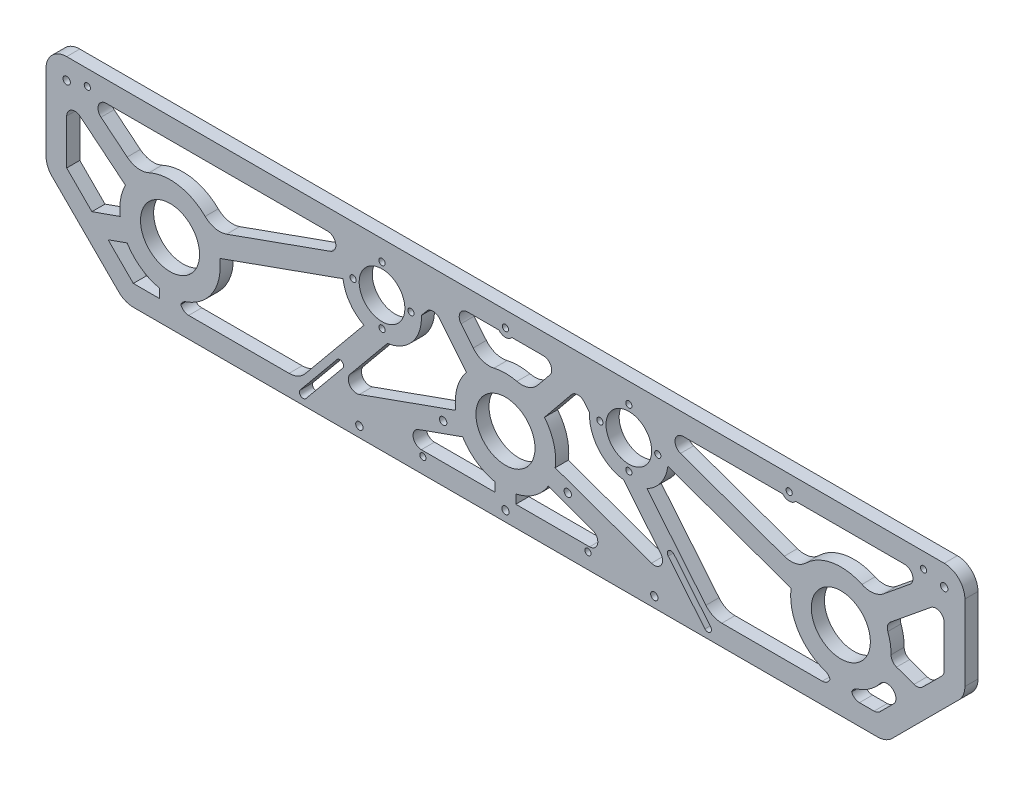
from build123d import *

# Parameters (mm, degrees)
SKETCH1_R           = 14.2875
BOSS_EXTRUDE1_DEPTH = 6.35
BOSS_EXTRUDE2_DEPTH = 6.35
FILLET1_R           = 10
FILLET2_R           = 4
FILLET3_R           = 4
SKETCH3_R           = 1.778
CUT_EXTRUDE1_DEPTH  = 10
CUT_EXTRUDE2_DEPTH  = 10
SKETCH6_R           = 19.05
SKETCH6_R_2         = 11.049
SKETCH6_R_3         = 1.5
BOSS_EXTRUDE3_DEPTH = 6.35
SKETCH6_5_R         = 11.049
SKETCH6_5_R_2       = 1.5
CUT_EXTRUDE4_DEPTH  = 10
SKETCH7_R           = 1.778
CUT_EXTRUDE5_DEPTH  = 10
SKETCH8_R           = 1.778
CUT_EXTRUDE6_DEPTH  = 10
SKETCH9_R           = 1.5
CUT_EXTRUDE7_DEPTH  = 10
SKETCH10_R          = 4
SKETCH10_R_2        = 1.5
BOSS_EXTRUDE4_DEPTH = 6.35
SKETCH10_4_R        = 1.5
CUT_EXTRUDE8_DEPTH  = 10


with BuildPart() as part:
    # Sketch1 → Boss-Extrude1 (new body)
    with BuildSketch(Plane.XY):
        with BuildLine():
            Line((2.928932188, 35.171067812), (35.171067812, 2.928932188))
            ThreePointArc((35.171067812, 2.928932188), (38.4153013, 0.761204675), (42.242135624, 0))
            Line((42.242135624, 0), (402.257864376, 0))
            ThreePointArc((402.257864376, 0), (406.0846987, 0.761204675), (409.328932188, 2.928932188))
            Line((409.328932188, 2.928932188), (441.571067812, 35.171067812))
            ThreePointArc((441.571067812, 35.171067812), (443.738795325, 38.4153013), (444.5, 42.242135624))
            Line((444.5, 42.242135624), (444.5, 78.9))
            ThreePointArc((444.5, 78.9), (441.571067812, 85.971067812), (434.5, 88.9))
            Line((434.5, 88.9), (10, 88.9))
            ThreePointArc((10, 88.9), (2.928932188, 85.971067812), (0, 78.9))
            Line((0, 78.9), (0, 42.242135624))
            ThreePointArc((0, 42.242135624), (0.761204675, 38.4153013), (2.928932188, 35.171067812))
        make_face()
        with Locations((60, 38.1)):
            Circle(SKETCH1_R, mode=Mode.SUBTRACT)
        with Locations((384.5, 38.1)):
            Circle(SKETCH1_R, mode=Mode.SUBTRACT)
        with Locations((222.25, 38.1)):
            Circle(SKETCH1_R, mode=Mode.SUBTRACT)
        with BuildLine():
            Line((42.242135624, 10), (55, 10))
            Line((55, 10), (55, 14.332739824))
            ThreePointArc((55, 14.332739824), (45.977844894, 18.269169901), (39.258984185, 25.463033624))
            Line((39.258984185, 25.463033624), (30.039080729, 22.203054895))
            Line((30.039080729, 22.203054895), (42.242135624, 10))
        make_face(mode=Mode.SUBTRACT)
        with BuildLine():
            Line((402.257864376, 10), (414.460919271, 22.203054895))
            Line((414.460919271, 22.203054895), (405.241015815, 25.463033624))
            ThreePointArc((405.241015815, 25.463033624), (398.522155106, 18.269169901), (389.5, 14.332739824))
            Line((389.5, 14.332739824), (389.5, 10))
            Line((389.5, 10), (402.257864376, 10))
        make_face(mode=Mode.SUBTRACT)
        with BuildLine():
            Line((434.5, 42.242135624), (434.5, 72.446597797))
            Line((434.5, 72.446597797), (406.075642814, 49.252322333))
            ThreePointArc((406.075642814, 49.252322333), (408.427959025, 42.263584169), (408.574576932, 34.891043503))
            Line((408.574576932, 34.891043503), (420.045712746, 30.835072751))
            Line((420.045712746, 30.835072751), (422.296945105, 30.039080729))
            Line((422.296945105, 30.039080729), (434.5, 42.242135624))
        make_face(mode=Mode.SUBTRACT)
        with BuildLine():
            Line((17.908581132, 78.9), (159.303289572, 78.9))
            Line((159.303289572, 78.9), (80.698128287, 50.807090212))
            ThreePointArc((80.698128287, 50.807090212), (64.123087075, 62.034970424), (44.746603764, 57.000173532))
            Line((44.746603764, 57.000173532), (17.908581132, 78.9))
        make_face(mode=Mode.SUBTRACT)
        with BuildLine():
            Line((10, 42.242135624), (10, 72.446597797))
            Line((10, 72.446597797), (38.424357186, 49.252322333))
            ThreePointArc((38.424357186, 49.252322333), (36.072040975, 42.263584169), (35.925423068, 34.891043503))
            Line((35.925423068, 34.891043503), (24.454287254, 30.835072751))
            Line((24.454287254, 30.835072751), (22.203054895, 30.039080729))
            Line((22.203054895, 30.039080729), (10, 42.242135624))
        make_face(mode=Mode.SUBTRACT)
        with BuildLine():
            Line((65, 14.332739824), (65, 10))
            Line((65, 10), (128.768147223, 10))
            Line((128.768147223, 10), (141.942274838, 14.708336864))
            Line((141.942274838, 14.708336864), (198.186421388, 34.809583517))
            ThreePointArc((198.186421388, 34.809583517), (198.85545044, 44.625159549), (203.363262878, 53.370030031))
            Line((203.363262878, 53.370030031), (185.140287975, 75.742288539))
            Line((185.140287975, 75.742288539), (184.022239752, 77.114910957))
            Line((184.022239752, 77.114910957), (175.842867511, 74.191663136))
            Line((175.842867511, 74.191663136), (84.063578612, 41.390416483))
            ThreePointArc((84.063578612, 41.390416483), (79.854530137, 24.1114229), (65, 14.332739824))
        make_face(mode=Mode.SUBTRACT)
        with BuildLine():
            Line((399.753396236, 57.000173532), (426.591418868, 78.9))
            Line((426.591418868, 78.9), (285.196710428, 78.9))
            Line((285.196710428, 78.9), (363.801871713, 50.807090212))
            ThreePointArc((363.801871713, 50.807090212), (380.376912925, 62.034970424), (399.753396236, 57.000173532))
        make_face(mode=Mode.SUBTRACT)
        with BuildLine():
            Line((158.481852777, 10), (201.551871713, 25.392909788))
            ThreePointArc((201.551871713, 25.392909788), (208.2614229, 18.245469863), (217.25, 14.332739824))
            Line((217.25, 14.332739824), (217.25, 10))
            Line((217.25, 10), (158.481852777, 10))
        make_face(mode=Mode.SUBTRACT)
        with BuildLine():
            Line((195.465766991, 78.9), (211.116677179, 59.685452953))
            ThreePointArc((211.116677179, 59.685452953), (222.25, 62.3875), (233.383322821, 59.685452953))
            Line((233.383322821, 59.685452953), (249.034233009, 78.9))
            Line((249.034233009, 78.9), (195.465766991, 78.9))
        make_face(mode=Mode.SUBTRACT)
        with BuildLine():
            Line((379.5, 14.332739824), (379.5, 10))
            Line((379.5, 10), (315.731852777, 10))
            Line((315.731852777, 10), (302.557725162, 14.708336864))
            Line((302.557725162, 14.708336864), (246.313578612, 34.809583517))
            ThreePointArc((246.313578612, 34.809583517), (245.64454956, 44.625159549), (241.136737122, 53.370030031))
            Line((241.136737122, 53.370030031), (259.359712025, 75.742288539))
            Line((259.359712025, 75.742288539), (260.477760248, 77.114910957))
            Line((260.477760248, 77.114910957), (268.657132489, 74.191663136))
            Line((268.657132489, 74.191663136), (360.436421388, 41.390416483))
            ThreePointArc((360.436421388, 41.390416483), (364.645469863, 24.1114229), (379.5, 14.332739824))
        make_face(mode=Mode.SUBTRACT)
        with BuildLine():
            Line((286.018147223, 10), (227.25, 10))
            Line((227.25, 10), (227.25, 14.332739824))
            ThreePointArc((227.25, 14.332739824), (236.2385771, 18.245469863), (242.948128287, 25.392909788))
            Line((242.948128287, 25.392909788), (286.018147223, 10))
        make_face(mode=Mode.SUBTRACT)
    extrude(amount=BOSS_EXTRUDE1_DEPTH)

    # Sketch2 → Boss-Extrude2 (add)
    with BuildSketch(Plane.XY.offset(6.35)):
        Polygon((184.022239752, 77.114910957), (174.845752388, 73.835301483), (124.908015982, 13.177953241), (122.291683488, 10), (128.768147223, 10), (137.944634587, 13.279609474), (187.243188129, 73.160568149), align=None)
        Polygon((269.654247612, 73.835301483), (319.591984018, 13.177953241), (322.208316512, 10), (315.731852777, 10), (306.555365413, 13.279609474), (257.256811871, 73.160568149), (260.477760248, 77.114910957), align=None)
    extrude(amount=-BOSS_EXTRUDE2_DEPTH)

    # Fillet1
    fillet1_edges = [part.edges().sort_by_distance(p)[0] for p in [
        (211.116677179, 59.685452953, 3.175),
        (233.383322821, 59.685452953, 3.175),
        (44.746603764, 57.000173532, 3.175),
        (80.698128287, 50.807090212, 3.175),
        (399.753396236, 57.000173532, 3.175),
        (363.801871713, 50.807090212, 3.175),
        (122.291683488, 10, 3.175),
        (322.208316512, 10, 3.175),
    ]]
    fillet(fillet1_edges, radius=FILLET1_R)

    # Fillet2
    fillet2_edges = [part.edges().sort_by_distance(p)[0] for p in [
        (249.034233009, 78.9, 3.175),
        (195.465766991, 78.9, 3.175),
        (286.018147223, 10, 3.175),
        (159.303289572, 78.9, 3.175),
        (17.908581132, 78.9, 3.175),
        (158.481852777, 10, 3.175),
        (10, 72.446597797, 3.175),
        (426.591418868, 78.9, 3.175),
        (285.196710428, 78.9, 3.175),
        (434.5, 72.446597797, 3.175),
        (174.845752388, 73.835301483, 3.175),
        (187.243188129, 73.160568149, 3.175),
        (137.944634587, 13.279609474, 3.175),
        (269.654247612, 73.835301483, 3.175),
        (306.555365413, 13.279609474, 3.175),
        (257.256811871, 73.160568149, 3.175),
    ]]
    fillet(fillet2_edges, radius=FILLET2_R)

    # Fillet3
    # the kernel refuses this fillet: 4 mm, written as the material it adds along each edge
    with BuildSketch(Plane(origin=(434.5, 42.242135624, 0), x_dir=(0, 1, 0), z_dir=(0, 0, 1)), Plane(origin=(402.257864376, 10, 0), x_dir=(0.7071067811865684, 0.7071067811865266, 0), z_dir=(0, 0, 1))) as fillet3_piece_1:
        with BuildLine():
            CenterArc((FILLET3_R * 0.414213562373, FILLET3_R), FILLET3_R, 225, 45)
            Line((-FILLET3_R * 0.292893218813, FILLET3_R * 0.292893218813), (0, 0))
            Line((0, 0), (FILLET3_R * 0.414213562373, 0))
        make_face()
    extrude(amount=6.35)
    with BuildSketch(Plane(origin=(422.296945105, 30.039080729, 0), x_dir=(-0.9428009879202438, 0.33335611165330736, 0), z_dir=(0, 0, 1))) as fillet3_piece_2:
        with BuildLine():
            CenterArc((FILLET3_R * 0.630618821441, -FILLET3_R), FILLET3_R, 90, 64.47260491)
            Line((-FILLET3_R * 0.271760517527, -FILLET3_R * 0.569057395232), (0, 0))
            Line((0, 0), (FILLET3_R * 0.630618821441, 0))
        make_face()
    extrude(amount=6.35)
    with BuildSketch(Plane(origin=(408.574576932, 34.891043503, 0), x_dir=(0.07422292500138471, 0.9972416745223992, 0), z_dir=(0, 0, 1)), Plane(origin=(389.5, 14.332739824, 0), x_dir=(0.9649431016089534, 0.262459159979783, 0), z_dir=(0, 0, 1)), Plane(origin=(65, 14.332739824, 0), x_dir=(0.9649431016089596, 0.2624591599797595, 0), z_dir=(0, 0, 1))) as fillet3_piece_3:
        with BuildLine():
            CenterArc((3.059187738, -3.993222777), FILLET3_R, 93.335760439, 71.44820939)
            Line((-0.800584668, -2.943386137), (0, 0))
            ThreePointArc((0, 0), (1.413219633, -0.04115045), (2.826439265, 0))
        make_face()
    extrude(amount=6.35)
    with BuildSketch(Plane(origin=(406.075642814, 49.252322333, 0), x_dir=(0.774785119901029, 0.632224657839243, 0), z_dir=(0, 0, 1))) as fillet3_piece_4:
        with BuildLine():
            CenterArc((3.050320928, -4), FILLET3_R, 90, 71.44820939)
            ThreePointArc((-0.741824875, -2.727353071), (-0.331204595, -1.374476848), (0, 0))
            Line((0, 0), (3.050320928, 0))
        make_face()
    extrude(amount=6.35)
    with BuildSketch(Plane(origin=(414.460919271, 22.203054895, 0), x_dir=(-0.9428009879202406, 0.33335611165331624, 0), z_dir=(0, 0, 1))) as fillet3_piece_5:
        with BuildLine():
            CenterArc((FILLET3_R * 1.58574398036, FILLET3_R), FILLET3_R, 154.47260491, 115.52739509)
            Line((FILLET3_R * 0.68336464139, FILLET3_R * 1.43094260477), (0, 0))
            Line((0, 0), (FILLET3_R * 1.58574398036, 0))
        make_face()
    extrude(amount=6.35)
    with BuildSketch(Plane(origin=(405.241015815, 25.463033624, 0), x_dir=(-0.5691164356367163, -0.82225694444508, 0), z_dir=(0, 0, 1)), Plane(origin=(379.5, 14.332739824, 0), x_dir=(-0.9649431016089597, 0.2624591599797589, 0), z_dir=(0, 0, 1))) as fillet3_piece_6:
        with BuildLine():
            CenterArc((3.059187738, 3.993222777), FILLET3_R, 195.216030171, 71.44820939)
            Line((-0.800584668, 2.943386137), (0, 0))
            ThreePointArc((0, 0), (1.413219633, 0.04115045), (2.826439265, 0))
        make_face()
    extrude(amount=6.35)
    with BuildSketch(Plane(origin=(389.5, 10, 0), x_dir=(1, 0, 0), z_dir=(0, 0, 1)), Plane(origin=(65, 10, 0), x_dir=(1, 0, 0), z_dir=(0, 0, 1))) as fillet3_piece_7:
        with BuildLine():
            CenterArc((FILLET3_R, FILLET3_R), FILLET3_R, 180, 90)
            Line((0, FILLET3_R), (0, 0))
            Line((0, 0), (FILLET3_R, 0))
        make_face()
    extrude(amount=6.35)
    with BuildSketch(Plane(origin=(379.5, 10, 0), x_dir=(-1, 0, 0), z_dir=(0, 0, 1))) as fillet3_piece_8:
        with BuildLine():
            CenterArc((FILLET3_R, -FILLET3_R), FILLET3_R, 90, 90)
            Line((0, -FILLET3_R), (0, 0))
            Line((0, 0), (FILLET3_R, 0))
        make_face()
    extrude(amount=6.35)

    # Sketch3 → Cut-Extrude1 (cut)
    with BuildSketch(Plane(origin=(0, 0, 0), x_dir=(-1, 0, 0), z_dir=(0, 0, -1))):
        with Locations((-434.5, 78.9)):
            Circle(SKETCH3_R)
        with Locations((-252.383355932, 27.330558961)):
            Circle(SKETCH3_R)
        with Locations((-192.116644068, 27.330558961)):
            Circle(SKETCH3_R)
        with Locations(Location((-10, 78.9, 0), (0, 0, 180))):
            Circle(SKETCH3_R)
    extrude(amount=-CUT_EXTRUDE1_DEPTH, mode=Mode.SUBTRACT)

    # Sketch4 → Cut-Extrude2 (cut)
    with BuildSketch(Plane(origin=(0, 0, 0), x_dir=(-1, 0, 0), z_dir=(0, 0, -1))):
        with BuildLine():
            Line((-300.963495888, 25.141127689), (-318.760034036, 3.524392738))
            ThreePointArc((-318.760034036, 3.524392738), (-321.262776878, 3.281810241), (-321.505359375, 5.784553082))
            Line((-321.505359375, 5.784553082), (-303.708821227, 27.401288034))
            ThreePointArc((-303.708821227, 27.401288034), (-301.206078385, 27.643870531), (-300.963495888, 25.141127689))
        make_face()
        with BuildLine():
            Line((-143.536504112, 25.141127689), (-125.739965964, 3.524392738))
            ThreePointArc((-125.739965964, 3.524392738), (-123.237223122, 3.281810241), (-122.994640625, 5.784553082))
            Line((-122.994640625, 5.784553082), (-140.791178773, 27.401288034))
            ThreePointArc((-140.791178773, 27.401288034), (-143.293921615, 27.643870531), (-143.536504112, 25.141127689))
        make_face()
    extrude(amount=-CUT_EXTRUDE2_DEPTH, mode=Mode.SUBTRACT)

    # Sketch6 → Boss-Extrude3 (add)
    # profile 1 of 2: a face of its own
    with BuildSketch(Plane(origin=(0, 0, 0), x_dir=(-1, 0, 0), z_dir=(0, 0, -1))):
        with Locations((-281.950469157, 65.192937402)):
            Circle(SKETCH6_R)
        with Locations((-281.950469157, 65.192937402)):
            Circle(SKETCH6_R_2, mode=Mode.SUBTRACT)
        with Locations((-281.950469157, 79.188337402)):
            Circle(SKETCH6_R_3, mode=Mode.SUBTRACT)
        with Locations((-267.955069157, 65.192937402)):
            Circle(SKETCH6_R_3, mode=Mode.SUBTRACT)
        with Locations((-281.950469157, 51.197537402)):
            Circle(SKETCH6_R_3, mode=Mode.SUBTRACT)
        with Locations((-295.945869157, 65.192937402)):
            Circle(SKETCH6_R_3, mode=Mode.SUBTRACT)
    # profile 2 of 2: a face of its own
    with BuildSketch(Plane(origin=(0, 0, 0), x_dir=(-1, 0, 0), z_dir=(0, 0, -1))):
        with Locations((-162.549530843, 65.192937402)):
            Circle(SKETCH6_R)
        with Locations((-148.554130843, 65.192937402)):
            Circle(SKETCH6_R_3, mode=Mode.SUBTRACT)
        with Locations((-162.549530843, 51.197537402)):
            Circle(SKETCH6_R_3, mode=Mode.SUBTRACT)
        with Locations((-176.544930843, 65.192937402)):
            Circle(SKETCH6_R_3, mode=Mode.SUBTRACT)
        with Locations((-162.549530843, 79.188337402)):
            Circle(SKETCH6_R_3, mode=Mode.SUBTRACT)
        with Locations((-162.549530843, 65.192937402)):
            Circle(SKETCH6_R_2, mode=Mode.SUBTRACT)
    extrude(amount=-BOSS_EXTRUDE3_DEPTH)

    # Sketch6<5> → Cut-Extrude4 (cut)
    with BuildSketch(Plane(origin=(0, 0, 0), x_dir=(-1, 0, 0), z_dir=(0, 0, -1))):
        with Locations(Location((-162.549530843, 65.192937402, 0), (0, 0, 180))):
            Circle(SKETCH6_5_R)
        with Locations((-162.549530843, 79.188337402)):
            Circle(SKETCH6_5_R_2)
        with Locations((-176.544930843, 65.192937402)):
            Circle(SKETCH6_5_R_2)
        with Locations((-162.549530843, 51.197537402)):
            Circle(SKETCH6_5_R_2)
        with Locations((-281.950469157, 65.192937402)):
            Circle(SKETCH6_5_R)
        with Locations((-281.950469157, 79.188337402)):
            Circle(SKETCH6_5_R_2)
        with Locations((-295.945869157, 65.192937402)):
            Circle(SKETCH6_5_R_2)
        with Locations((-281.950469157, 51.197537402)):
            Circle(SKETCH6_5_R_2)
        with Locations(Location((-148.554130843, 65.192937402, 0), (0, 0, 180))):
            Circle(SKETCH6_5_R_2)
        with Locations((-267.955069157, 65.192937402)):
            Circle(SKETCH6_5_R_2)
    extrude(amount=-CUT_EXTRUDE4_DEPTH, mode=Mode.SUBTRACT)

    # Sketch7 → Cut-Extrude5 (cut)
    with BuildSketch(Plane.XY.offset(6.35)):
        with Locations((222.25, 5)):
            Circle(SKETCH7_R)
    extrude(amount=-CUT_EXTRUDE5_DEPTH, mode=Mode.SUBTRACT)

    # Sketch8 → Cut-Extrude6 (cut)
    with BuildSketch(Plane.XY.offset(6.35)):
        with Locations((151.587036262, 5)):
            Circle(SKETCH8_R)
        with Locations((294.259143867, 5)):
            Circle(SKETCH8_R)
    extrude(amount=-CUT_EXTRUDE6_DEPTH, mode=Mode.SUBTRACT)

    # Sketch9 → Cut-Extrude7 (cut)
    with BuildSketch(Plane(origin=(0, 0, 0), x_dir=(-1, 0, 0), z_dir=(0, 0, -1))):
        with Locations((-424.5, 81.4)):
            Circle(SKETCH9_R)
        with Locations((-262.171798557, 7.5)):
            Circle(SKETCH9_R)
        with Locations(Location((-182.328201443, 7.5, 0), (0, 0, 180))):
            Circle(SKETCH9_R)
        with Locations(Location((-20, 81.4, 0), (0, 0, 180))):
            Circle(SKETCH9_R)
        with Locations((-222.25, 81.4)):
            Circle(SKETCH9_R)
    extrude(amount=-CUT_EXTRUDE7_DEPTH, mode=Mode.SUBTRACT)

    # Sketch10 → Boss-Extrude4 (add, through all)
    # profile 1 of 2: a face of its own
    with BuildSketch(Plane(origin=(0, 0, 0), x_dir=(-1, 0, 0), z_dir=(0, 0, -1))):
        with Locations((-359.5, 81.4)):
            Circle(SKETCH10_R)
        with Locations((-359.5, 81.4)):
            Circle(SKETCH10_R_2, mode=Mode.SUBTRACT)
    # profile 2 of 2: a face of its own
    with BuildSketch(Plane(origin=(0, 0, 0), x_dir=(-1, 0, 0), z_dir=(0, 0, -1))):
        with Locations((-222.25, 81.4)):
            Circle(SKETCH10_R)
        with Locations((-222.25, 81.4)):
            Circle(SKETCH10_R_2, mode=Mode.SUBTRACT)
    extrude(amount=-BOSS_EXTRUDE4_DEPTH)

    # Sketch10<4> → Cut-Extrude8 (cut)
    with BuildSketch(Plane(origin=(0, 0, 0), x_dir=(-1, 0, 0), z_dir=(0, 0, -1))):
        with Locations((-359.5, 81.4)):
            Circle(SKETCH10_4_R)
    extrude(amount=-CUT_EXTRUDE8_DEPTH, mode=Mode.SUBTRACT)


solid = part.part
